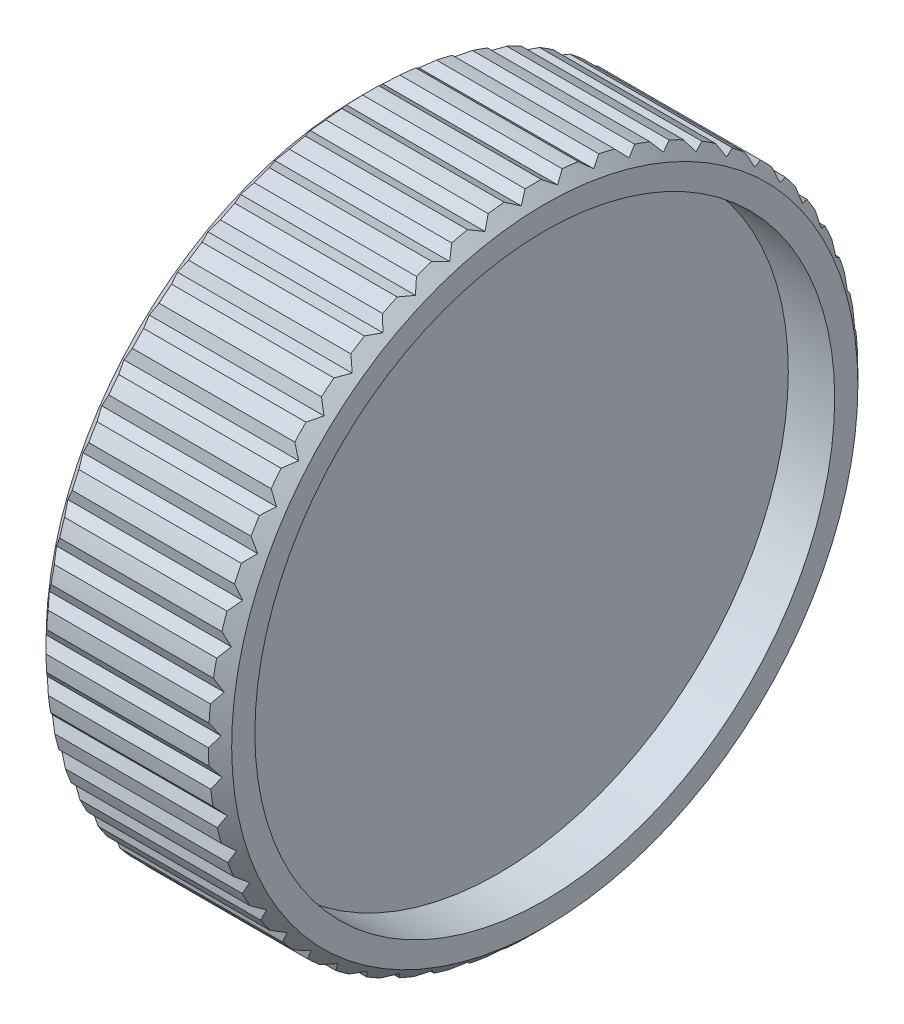
from build123d import *

# Parameters (mm, degrees)
SKETCH1_R           = 28
BOSS_EXTRUDE1_DEPTH = 8
CHAMFER1_SIZE       = 1
SKETCH3_R           = 25
CUT_EXTRUDE2_DEPTH  = 4
CUT_EXTRUDE3_DEPTH  = 43.708313008
CIRPATTERN1_COUNT   = 55


with BuildPart() as part:
    # Sketch1 → Boss-Extrude1 (new, symmetric)
    with BuildSketch(Plane(origin=(0, 0, 0), x_dir=(0, 0, -1), z_dir=(1, 0, 0))):
        Circle(SKETCH1_R)
    extrude(amount=BOSS_EXTRUDE1_DEPTH, both=True)

    # Chamfer1
    chamfer1_edges = [part.edges().sort_by_distance(p)[0] for p in [
        (-8, 0, 28),
        (8, 0, 28),
    ]]
    chamfer(chamfer1_edges, length=CHAMFER1_SIZE)

    # Sketch3 → Cut-Extrude2 (cut)
    with BuildSketch(Plane(origin=(8, 0, 0), x_dir=(0, 0, -1), z_dir=(1, 0, 0))):
        Circle(SKETCH3_R)
    cut_extrude2 = extrude(amount=-CUT_EXTRUDE2_DEPTH, mode=Mode.SUBTRACT)

    # Mirror1: Cut-Extrude2 across plane
    add(cut_extrude2.mirror(Plane(origin=(0, 0, 0), x_dir=(0, 0, 1), z_dir=(1, 0, 0))), mode=Mode.SUBTRACT)

    # Sketch4 → Cut-Extrude3 (cut, through all)
    with BuildSketch(Plane(origin=(8, 0, 0), x_dir=(0, 0, -1), z_dir=(1, 0, 0))):
        Polygon((0, -27.464101615), (-8.660254038, -32.464101615), (8.660254038, -32.464101615), align=None)
    cut_extrude3 = extrude(amount=-CUT_EXTRUDE3_DEPTH, mode=Mode.SUBTRACT)

    # CirPattern1: Cut-Extrude3 ×55 about axis
    cirpattern1_axis = Axis((8, 0, 0), (1, 0, 0))
    for i in range(1, CIRPATTERN1_COUNT):
        add(cut_extrude3.rotate(cirpattern1_axis, i * 360 / CIRPATTERN1_COUNT), mode=Mode.SUBTRACT)


solid = part.part
